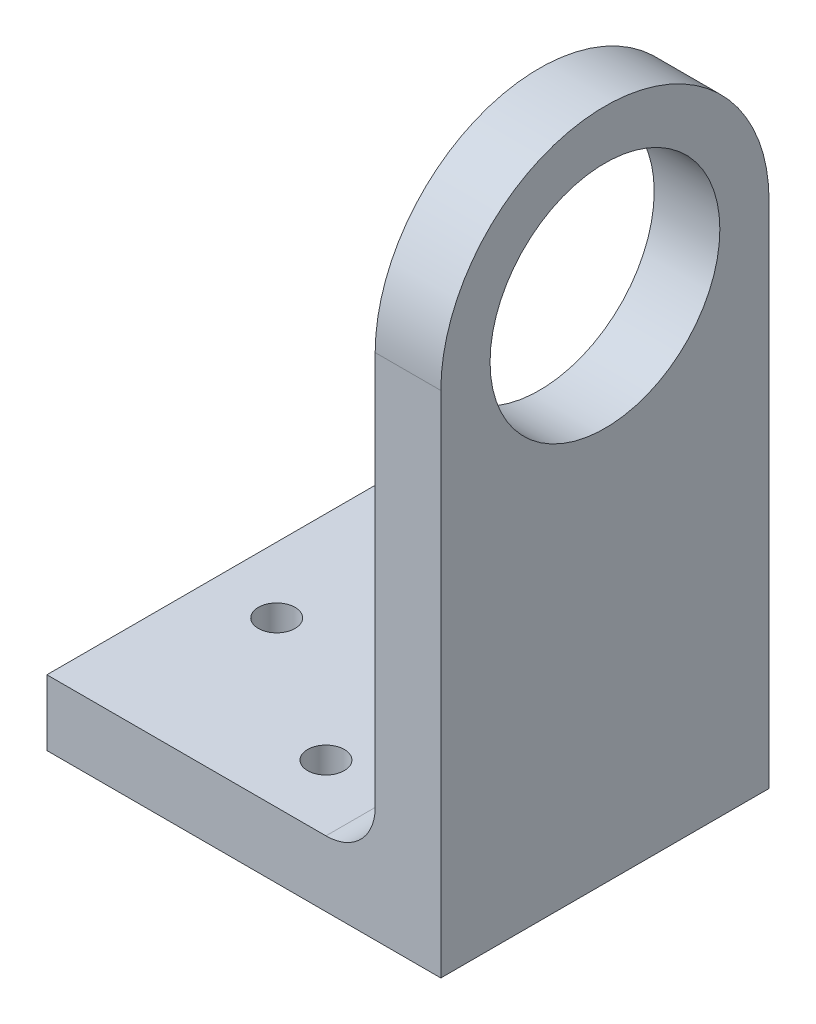
from build123d import *

# Parameters (mm, degrees)
SKETCH3_R           = 11.1125
BOSS_EXTRUDE1_DEPTH = 6.35
SKETCH5_W           = 31.75
SKETCH5_H           = 6.35
BOSS_EXTRUDE2_DEPTH = 38.1
FILLET1_R           = 4.7625
SKETCH6_R           = 1.777000002
CUT_EXTRUDE1_DEPTH  = 74.933881991


with BuildPart() as part:
    # Sketch3 → Boss-Extrude1 (new body)
    with BuildSketch(Plane(origin=(0, 0, 0), x_dir=(0, 0, -1), z_dir=(1, 0, 0))):
        with BuildLine():
            Line((0, 0), (31.75, 0))
            Line((31.75, 0), (31.75, 42.8625))
            ThreePointArc((31.75, 42.8625), (15.875, 58.7375), (0, 42.8625))
            Line((0, 42.8625), (0, 0))
        make_face()
        with Locations((15.875, 42.8625)):
            Circle(SKETCH3_R, mode=Mode.SUBTRACT)
    extrude(amount=BOSS_EXTRUDE1_DEPTH)

    # Sketch5 → Boss-Extrude2 (add)
    with BuildSketch(Plane(origin=(6.35, 0, 0), x_dir=(0, 0, -1), z_dir=(1, 0, 0))):
        with Locations((15.875, -3.175)):
            Rectangle(SKETCH5_W, SKETCH5_H)
    extrude(amount=-BOSS_EXTRUDE2_DEPTH)

    # Fillet1
    fillet1_edges = [part.edges().sort_by_distance(p)[0] for p in [
        (0, 0, -15.875),
    ]]
    fillet(fillet1_edges, radius=FILLET1_R)

    # Sketch6 → Cut-Extrude1 (cut, through all)
    with BuildSketch(Plane(origin=(0, 0, 0), x_dir=(1, 0, 0), z_dir=(0, 1, 0))):
        with Locations((-11.1125, 6.35)):
            Circle(SKETCH6_R)
        with Locations((-25.4, 15.875)):
            Circle(SKETCH6_R)
        with Locations((-11.1125, 25.4)):
            Circle(SKETCH6_R)
    extrude(amount=-CUT_EXTRUDE1_DEPTH, mode=Mode.SUBTRACT)


solid = part.part
